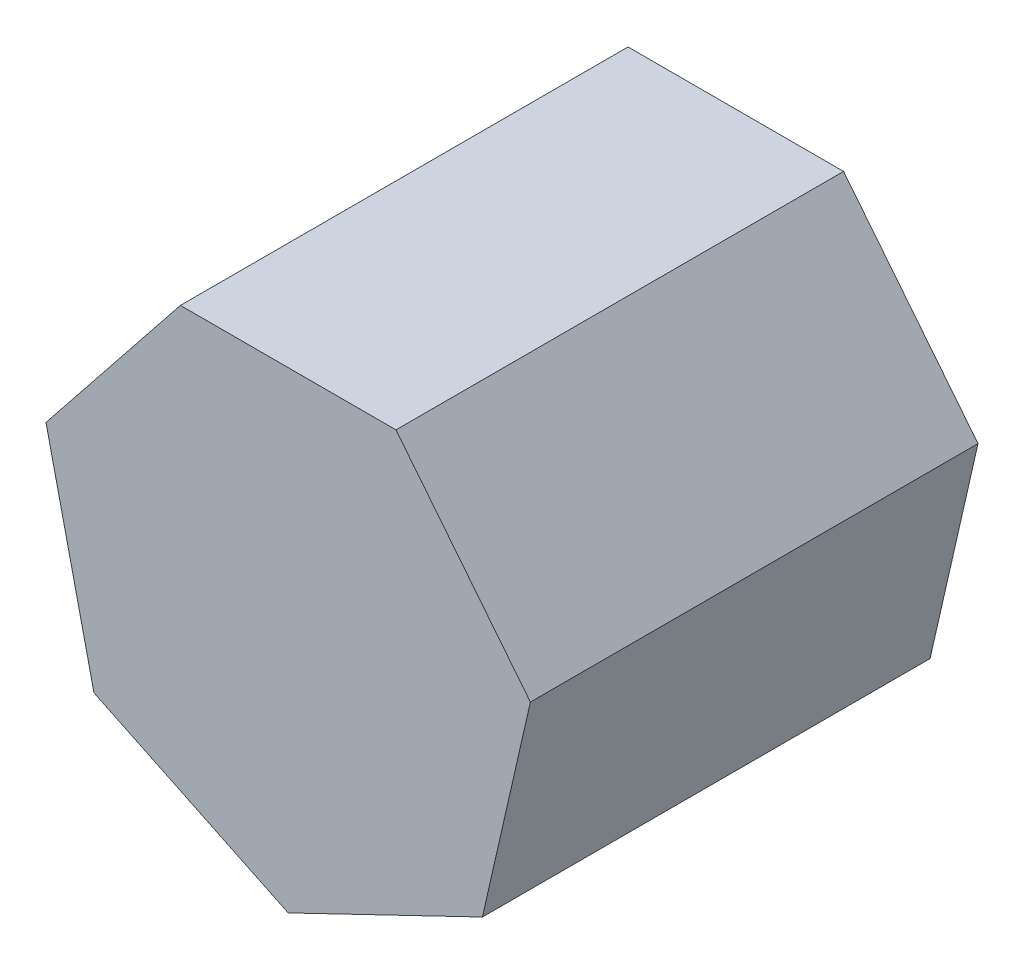
from build123d import *

# Parameters (mm, degrees)
BOSS_EXTRUDE1_DEPTH = 200
CUT_EXTRUDE1_DEPTH  = 1
SKETCH4_W           = 1.794871794
SKETCH4_H           = 20.512820513
SKETCH4_W_2         = 1.794871795
SKETCH4_H_2         = 14.615384616
CUT_EXTRUDE3_DEPTH  = 1
CUT_EXTRUDE5_DEPTH  = 2


with BuildPart() as part:
    # Sketch1 → Boss-Extrude1 (new body)
    with BuildSketch(Plane.XY):
        Polygon((0, -110.991626417), (86.776747824, -69.202147163), (108.208834613, 24.697960372), (48.157461881, 100), (-48.157461881, 100), (-108.208834613, 24.697960372), (-86.776747824, -69.202147163), align=None)
    extrude(amount=BOSS_EXTRUDE1_DEPTH)

    # Sketch2 → Cut-Extrude1 (cut)
    # profile 1 of 6: a face of its own
    with BuildSketch(Plane(origin=(-78.183148247, 62.348980186, 0), x_dir=(0, 0, 1), z_dir=(-0.7818314824680302, 0.6234898018587328, 0))):
        with BuildLine():
            Line((145.128205128, -35.364993932), (143.91025641, -36.619000342))
            add(Edge.make_bspline(
                [(143.91025641, -36.619000342), (143.805167819, -36.497210935), (143.602569386, -36.262415294), (143.281246637, -35.9484892), (142.961111759, -35.684849549), (142.64654711, -35.462265212), (142.329642716, -35.293984375), (142.014117469, -35.171156592), (141.699644678, -35.095146274), (141.489438762, -35.085349481), (141.386217949, -35.080538804)],
                knots=[0, 0, 0, 0, 1.26578478, 2.440284043, 3.530471711, 4.527705817, 5.468200915, 6.346673037, 7.188140097, 8, 8, 8, 8], degree=3))
            add(Edge.make_bspline(
                [(141.386217949, -35.080538804), (141.25970715, -35.086680935), (141.010751801, -35.09876778), (140.65403284, -35.219415954), (140.322886411, -35.404608745), (140.036275097, -35.667286365), (139.793488354, -35.968796473), (139.616267319, -36.305918329), (139.50789027, -36.668478579), (139.494148944, -36.920077766), (139.487179487, -37.04768624)],
                knots=[0, 0, 0, 0, 0.99966794, 1.967205029, 2.953328237, 3.988086729, 5.028030931, 6.008226631, 6.989793394, 8, 8, 8, 8], degree=3))
            add(Edge.make_bspline(
                [(139.487179487, -37.04768624), (139.493526986, -37.163183635), (139.50620409, -37.39385284), (139.604756542, -37.734127319), (139.761705526, -38.065881823), (139.908392351, -38.26909843), (139.983974359, -38.373808035)],
                knots=[0, 0, 0, 0, 0.960159726, 1.917612774, 2.927026955, 4, 4, 4, 4], degree=3))
            add(Edge.make_bspline(
                [(139.983974359, -38.373808035), (140.029480038, -38.429719945), (140.126333139, -38.5487214), (140.308096082, -38.713886276), (140.513938956, -38.896413425), (140.761481457, -39.078909636), (141.040058759, -39.271090923), (141.355711812, -39.465388826), (141.698423269, -39.676614111), (141.943779307, -39.810582314), (142.071314103, -39.880218291)],
                knots=[0, 0, 0, 0, 0.66740084, 1.420478572, 2.27185888, 3.217733974, 4.268547843, 5.408967954, 6.65319498, 8, 8, 8, 8], degree=3))
            add(Edge.make_bspline(
                [(142.071314103, -39.880218291), (142.226820257, -39.967332021), (142.527206943, -40.135607064), (142.954022756, -40.396805369), (143.341377276, -40.656413508), (143.69255252, -40.911655073), (144.000791428, -41.169671459), (144.275446014, -41.420572928), (144.509665694, -41.671940404), (144.640830989, -41.847558196), (144.703525641, -41.931500342)],
                knots=[0, 0, 0, 0, 1.27191281, 2.456916733, 3.569705269, 4.599008579, 5.553216877, 6.436649441, 7.252746552, 8, 8, 8, 8], degree=3))
            add(Edge.make_bspline(
                [(144.703525641, -41.931500342), (144.807585798, -42.101020845), (145.014684822, -42.438398109), (145.232160631, -42.99393198), (145.358219344, -43.583134851), (145.375717745, -43.986176109), (145.384615385, -44.191115727)],
                knots=[0, 0, 0, 0, 0.995354457, 1.980940102, 2.973342416, 4, 4, 4, 4], degree=3))
            add(Edge.make_bspline(
                [(145.384615385, -44.191115727), (145.380503763, -44.335510848), (145.372401363, -44.620057209), (145.316069552, -45.039113379), (145.219183973, -45.439882279), (145.087219665, -45.826712477), (144.909023248, -46.192192132), (144.700178693, -46.545542126), (144.449464911, -46.879118874), (144.163228479, -47.19248436), (143.849825657, -47.478688631), (143.515504866, -47.730254082), (143.159854405, -47.939250295), (142.78541554, -48.112195125), (142.391337517, -48.249728027), (141.977558721, -48.344942491), (141.545394409, -48.401929698), (141.251509791, -48.40984099), (141.101762821, -48.413872137)],
                knots=[0, 0, 0, 0, 1.032770009, 2.035186124, 3.017557409, 3.978232242, 4.952395191, 5.920591857, 6.910227898, 7.931268572, 8.952309245, 9.941945286, 10.918353717, 11.897095711, 12.887975737, 13.898235213, 14.929059601, 16, 16, 16, 16], degree=3))
            add(Edge.make_bspline(
                [(141.101762821, -48.413872137), (140.899664675, -48.408199564), (140.498276521, -48.396933237), (139.904620983, -48.291184316), (139.324502362, -48.126639208), (138.762310703, -47.899691013), (138.230618624, -47.613115511), (137.744156198, -47.269901833), (137.301233555, -46.881387562), (137.049129134, -46.583599501), (136.923076923, -46.43470547)],
                knots=[0, 0, 0, 0, 1.013940152, 2.01379169, 3.017749504, 4.037548394, 5.051665909, 6.043208538, 7.021604269, 8, 8, 8, 8], degree=3))
            Line((136.923076923, -46.43470547), (138.112980769, -45.080538804))
            add(Edge.make_bspline(
                [(138.112980769, -45.080538804), (138.225965986, -45.20256603), (138.445004913, -45.439134258), (138.795297581, -45.75413049), (139.151751301, -46.018137754), (139.510806653, -46.238957267), (139.877778621, -46.409102428), (140.250610702, -46.52863725), (140.628544554, -46.605461206), (140.88238533, -46.614479962), (141.009615385, -46.619000342)],
                knots=[0, 0, 0, 0, 1.179806542, 2.287233372, 3.337373186, 4.324005949, 5.273901747, 6.200048787, 7.097828587, 8, 8, 8, 8], degree=3))
            add(Edge.make_bspline(
                [(141.009615385, -46.619000342), (141.182860676, -46.611167057), (141.521352913, -46.595862133), (142.006174391, -46.456907321), (142.453823685, -46.239021882), (142.842528517, -45.929966464), (143.173398009, -45.570220335), (143.412987577, -45.164996796), (143.563137151, -44.726188472), (143.580771429, -44.422003886), (143.58974359, -44.267237522)],
                knots=[0, 0, 0, 0, 1.072336372, 2.095165389, 3.102688358, 4.141489647, 5.156069229, 6.117746104, 7.042326257, 8, 8, 8, 8], degree=3))
            add(Edge.make_bspline(
                [(143.58974359, -44.267237522), (143.583536194, -44.139753987), (143.571280521, -43.888054811), (143.475033252, -43.523767148), (143.322959811, -43.178228402), (143.173218963, -42.976001846), (143.096955128, -42.873006753)],
                knots=[0, 0, 0, 0, 1.013901739, 2.00181326, 2.98231254, 4, 4, 4, 4], degree=3))
            add(Edge.make_bspline(
                [(143.096955128, -42.873006753), (143.051112874, -42.821376112), (142.951251889, -42.708905929), (142.768079082, -42.546476907), (142.548754155, -42.371402054), (142.290810367, -42.186650118), (141.993727727, -41.994658087), (141.656302153, -41.796433217), (141.283156139, -41.582560499), (141.01932396, -41.440733897), (140.881410256, -41.366596496)],
                knots=[0, 0, 0, 0, 0.615000592, 1.339693406, 2.178160186, 3.116406724, 4.166410947, 5.330106347, 6.604359322, 8, 8, 8, 8], degree=3))
            add(Edge.make_bspline(
                [(140.881410256, -41.366596496), (140.732572313, -41.283515744), (140.443928042, -41.122395651), (140.035086379, -40.871446621), (139.666244355, -40.616205051), (139.328526786, -40.370988827), (139.030463897, -40.122869147), (138.773229907, -39.871570567), (138.546697245, -39.62722779), (138.421283463, -39.45410038), (138.361378205, -39.371404188)],
                knots=[0, 0, 0, 0, 1.262093308, 2.447601706, 3.550203992, 4.582594899, 5.537233252, 6.418365656, 7.244515135, 8, 8, 8, 8], degree=3))
            add(Edge.make_bspline(
                [(138.361378205, -39.371404188), (138.257774779, -39.204857817), (138.05053172, -38.871706872), (137.849302056, -38.315647005), (137.710981891, -37.730246678), (137.698625376, -37.326321796), (137.692307692, -37.119801624)],
                knots=[0, 0, 0, 0, 0.985009483, 1.970363186, 2.962279964, 4, 4, 4, 4], degree=3))
            add(Edge.make_bspline(
                [(137.692307692, -37.119801624), (137.695360237, -36.98479935), (137.701334499, -36.720580773), (137.749014794, -36.332358943), (137.835824572, -35.96351235), (137.944709844, -35.608501704), (138.096041298, -35.274204024), (138.276875042, -34.956161332), (138.489374613, -34.654813229), (138.734193418, -34.374795331), (139.003374248, -34.120456324), (139.294201504, -33.898749878), (139.600134398, -33.709570708), (139.922468224, -33.550912648), (140.264299498, -33.430904747), (140.623238849, -33.348291118), (140.998559734, -33.293118531), (141.255137597, -33.28818662), (141.386217949, -33.285667009)],
                knots=[0, 0, 0, 0, 1.087655834, 2.128696564, 3.144119009, 4.137814668, 5.115653402, 6.093965665, 7.082169637, 8.081268856, 9.086088321, 10.061021666, 11.022561449, 11.980240094, 12.950172527, 13.934149372, 14.944599409, 16, 16, 16, 16], degree=3))
            add(Edge.make_bspline(
                [(141.386217949, -33.285667009), (141.541601169, -33.291977527), (141.855282436, -33.304716943), (142.325880299, -33.405892317), (142.795785111, -33.572367198), (143.266204254, -33.802288531), (143.733691622, -34.099813536), (144.202359374, -34.459409533), (144.677833833, -34.878710759), (144.974727051, -35.199277761), (145.128205128, -35.364993932)],
                knots=[0, 0, 0, 0, 0.845714091, 1.707292901, 2.609013841, 3.555613372, 4.552488639, 5.621697636, 6.770543573, 8, 8, 8, 8], degree=3))
        make_face()
    # profile 2 of 6: a face of its own
    with BuildSketch(Plane(origin=(-78.183148247, 62.348980186, 0), x_dir=(0, 0, 1), z_dir=(-0.7818314824680302, 0.6234898018587328, 0))):
        with BuildLine():
            Line((132.251602564, -43.542077265), (133.846153846, -44.379417009))
            add(Edge.make_bspline(
                [(133.846153846, -44.379417009), (133.719087588, -44.604807473), (133.471866968, -45.043328061), (133.046719837, -45.645795835), (132.601050851, -46.187782783), (132.114742462, -46.654809379), (131.602344297, -47.06196015), (131.061014841, -47.418176291), (130.487935882, -47.721710693), (129.883080312, -47.977439424), (129.241368591, -48.174065104), (128.56124564, -48.312946367), (127.841408524, -48.398793616), (127.348001782, -48.408765849), (127.095352564, -48.413872137)],
                knots=[0, 0, 0, 0, 1.120438281, 2.179929193, 3.190490725, 4.156257408, 5.095198341, 6.022838206, 6.959905092, 7.901321166, 8.864066838, 9.862729781, 10.905609505, 12, 12, 12, 12], degree=3))
            add(Edge.make_bspline(
                [(127.095352564, -48.413872137), (126.814541264, -48.40731685), (126.266759769, -48.394529383), (125.469389785, -48.284286729), (124.718650252, -48.104444679), (124.014583375, -47.853213013), (123.35891336, -47.525056876), (122.750337047, -47.125288408), (122.185654042, -46.655961239), (121.682658561, -46.113010133), (121.229836374, -45.531970377), (120.83026026, -44.92650818), (120.496217797, -44.298146897), (120.224488596, -43.65088676), (120.005032225, -42.988807368), (119.852079632, -42.305884696), (119.763909643, -41.603967072), (119.750398526, -41.129125154), (119.743589744, -40.889833676)],
                knots=[0, 0, 0, 0, 1.145258523, 2.234067595, 3.276747158, 4.290159414, 5.277019952, 6.260822364, 7.254936242, 8.264827045, 9.274100331, 10.257902744, 11.220704747, 12.172965371, 13.118907548, 14.062713208, 15.023725156, 16, 16, 16, 16], degree=3))
            add(Edge.make_bspline(
                [(119.743589744, -40.889833676), (119.74964198, -40.665291788), (119.761636713, -40.220279418), (119.837241212, -39.561619163), (119.971231458, -38.921456578), (120.155096166, -38.299259732), (120.392531859, -37.696070395), (120.683001683, -37.11152146), (121.026958127, -36.546234946), (121.292516263, -36.189645611), (121.426282051, -36.010025983)],
                knots=[0, 0, 0, 0, 1.024358464, 2.0301432, 3.019427413, 4.004406732, 4.986367066, 5.972626655, 6.978780325, 8, 8, 8, 8], degree=3))
            add(Edge.make_bspline(
                [(121.426282051, -36.010025983), (121.60746881, -35.79363244), (121.964102791, -35.367700152), (122.567281964, -34.808052576), (123.220425943, -34.339231003), (123.915349521, -33.950618797), (124.660129373, -33.655340814), (125.444753893, -33.435297487), (126.278157243, -33.311994567), (126.847901362, -33.294578375), (127.139423077, -33.285667009)],
                knots=[0, 0, 0, 0, 1.030682036, 2.02871468, 2.997146059, 3.962720338, 4.930598197, 5.918074684, 6.934738563, 8, 8, 8, 8], degree=3))
            add(Edge.make_bspline(
                [(127.139423077, -33.285667009), (127.439123679, -33.293404431), (128.027067941, -33.30858349), (128.884394347, -33.449305395), (129.695598442, -33.67246285), (130.460355609, -33.987627367), (131.178743385, -34.394253377), (131.84609224, -34.897921043), (132.473815168, -35.483167255), (132.839007048, -35.933242738), (133.024839744, -36.162269573)],
                knots=[0, 0, 0, 0, 1.056321875, 2.072262726, 3.055038591, 4.01806755, 4.982017516, 5.957941055, 6.960871419, 8, 8, 8, 8], degree=3))
            add(Edge.make_bspline(
                [(133.024839744, -36.162269573), (133.151279391, -36.334861467), (133.403317066, -36.678896431), (133.71901478, -37.239874471), (133.993057037, -37.826792153), (134.212102529, -38.449136708), (134.389471107, -39.099534309), (134.517795786, -39.782634564), (134.593050749, -40.498234058), (134.607843305, -40.985814375), (134.615384615, -41.234384958)],
                knots=[0, 0, 0, 0, 0.94817472, 1.890038105, 2.849395472, 3.817997239, 4.812318967, 5.836947057, 6.897266129, 8, 8, 8, 8], degree=3))
            Line((134.615384615, -41.234384958), (121.538461538, -41.234384958))
            add(Edge.make_bspline(
                [(121.538461538, -41.234384958), (121.547259289, -41.426959039), (121.564559712, -41.805648203), (121.645217673, -42.359766964), (121.772353523, -42.887614633), (121.951033881, -43.385232016), (122.167415854, -43.859118459), (122.432477093, -44.30575867), (122.748703115, -44.723118271), (123.101421398, -45.114930485), (123.494033371, -45.463849121), (123.907077641, -45.776144985), (124.346469441, -46.037891252), (124.808744203, -46.250347765), (125.293154404, -46.416669571), (125.799852662, -46.530199975), (126.327841898, -46.606240585), (126.687760379, -46.614695815), (126.87099359, -46.619000342)],
                knots=[0, 0, 0, 0, 1.094153842, 2.151609401, 3.174256925, 4.172055639, 5.149267565, 6.128595816, 7.11444997, 8.118368179, 9.117203808, 10.09244225, 11.054858984, 12.015122123, 12.976791628, 13.957293641, 14.960065497, 16, 16, 16, 16], degree=3))
            add(Edge.make_bspline(
                [(126.87099359, -46.619000342), (127.050143005, -46.615525733), (127.40560981, -46.608631441), (127.934986138, -46.54159195), (128.455783437, -46.433190375), (128.965846199, -46.285247575), (129.454822461, -46.10480842), (129.907654176, -45.887077805), (130.324112551, -45.646222109), (130.71335236, -45.370738252), (131.090900893, -45.033548612), (131.465429387, -44.612773063), (131.867010263, -44.115130047), (132.118379365, -43.740583384), (132.251602564, -43.542077265)],
                knots=[0, 0, 0, 0, 0.99110716, 1.966546729, 2.947904876, 3.932708344, 4.903319531, 5.828989031, 6.710028674, 7.56322171, 8.463672341, 9.504779593, 10.677557249, 12, 12, 12, 12], degree=3))
        make_face()
        with BuildLine():
            add(Edge.make_bspline(
                [(132.820512821, -39.439513163), (132.754817823, -39.201439599), (132.6283761, -38.743224624), (132.364168303, -38.10870525), (132.066616642, -37.544774387), (131.714492463, -37.055747912), (131.315528317, -36.621442124), (130.854698701, -36.241907352), (130.337922167, -35.90237906), (129.767869935, -35.615793349), (129.164202592, -35.371851299), (128.532167209, -35.208279209), (127.887265564, -35.096224681), (127.451069642, -35.085789776), (127.231570513, -35.080538804)],
                knots=[0, 0, 0, 0, 1.154881502, 2.222775134, 3.210006277, 4.132804581, 5.035138423, 5.962687519, 6.919655026, 7.923214229, 8.944639381, 9.960483929, 10.97369054, 12, 12, 12, 12], degree=3))
            add(Edge.make_bspline(
                [(127.231570513, -35.080538804), (127.052430864, -35.08403407), (126.698309441, -35.090943476), (126.176589051, -35.156487072), (125.6755622, -35.264829043), (125.191531985, -35.413200223), (124.730841309, -35.610963666), (124.284014062, -35.842867818), (123.862411798, -36.125962583), (123.598747252, -36.341727468), (123.465544872, -36.450731112)],
                knots=[0, 0, 0, 0, 1.04873581, 2.073130211, 3.073294108, 4.04793562, 5.032784715, 6.005352987, 6.992311501, 8, 8, 8, 8], degree=3))
            add(Edge.make_bspline(
                [(123.465544872, -36.450731112), (123.370154689, -36.536984344), (123.177108208, -36.711539864), (122.919162371, -37.012278187), (122.672188241, -37.336572828), (122.447424511, -37.696830683), (122.241266874, -38.08894942), (122.048352719, -38.509621621), (121.874716078, -38.962039509), (121.777024021, -39.27731059), (121.726762821, -39.439513163)],
                knots=[0, 0, 0, 0, 0.879870761, 1.780643979, 2.707998968, 3.669668524, 4.684282772, 5.740141944, 6.837334558, 8, 8, 8, 8], degree=3))
            Line((121.726762821, -39.439513163), (132.820512821, -39.439513163))
        make_face(mode=Mode.SUBTRACT)
    # profile 3 of 6: a face of its own
    with BuildSketch(Plane(origin=(-78.183148247, 62.348980186, 0), x_dir=(0, 0, 1), z_dir=(-0.7818314824680302, 0.6234898018587328, 0))):
        with BuildLine():
            Line((111.538461538, -33.542077265), (113.333333333, -33.542077265))
            Line((113.333333333, -33.542077265), (113.333333333, -35.693519573))
            add(Edge.make_bspline(
                [(113.333333333, -35.693519573), (113.465840526, -35.493200554), (113.719259503, -35.110091987), (114.140476242, -34.603410267), (114.571923849, -34.183895715), (115.015667777, -33.849589893), (115.474971205, -33.599229214), (115.939753786, -33.415840442), (116.4173279, -33.307398641), (116.738253181, -33.29292059), (116.899038462, -33.285667009)],
                knots=[0, 0, 0, 0, 1.2804753, 2.448899062, 3.506932113, 4.484331642, 5.4025378, 6.288909075, 7.142734305, 8, 8, 8, 8], degree=3))
            add(Edge.make_bspline(
                [(116.899038462, -33.285667009), (117.023760327, -33.292470018), (117.280383671, -33.306467651), (117.668855613, -33.404815221), (118.06910391, -33.561832493), (118.327060408, -33.709490908), (118.461538462, -33.786468291)],
                knots=[0, 0, 0, 0, 0.901110191, 1.854092781, 2.881294221, 4, 4, 4, 4], degree=3))
            Line((118.461538462, -33.786468291), (117.475961538, -35.34095547))
            add(Edge.make_bspline(
                [(117.475961538, -35.34095547), (117.389624275, -35.302439664), (117.22573962, -35.22932929), (116.985999242, -35.142803518), (116.764963032, -35.091855428), (116.624142698, -35.084137042), (116.55849359, -35.080538804)],
                knots=[0, 0, 0, 0, 1.180555205, 2.24091978, 3.179933427, 4, 4, 4, 4], degree=3))
            add(Edge.make_bspline(
                [(116.55849359, -35.080538804), (116.414460827, -35.090139017), (116.120675741, -35.10972067), (115.689335745, -35.263656715), (115.270780285, -35.512372372), (114.938370786, -35.788207297), (114.680986483, -36.054194711), (114.497328052, -36.286471297), (114.328855212, -36.54692062), (114.167882524, -36.831090242), (114.021217986, -37.143832219), (113.884334162, -37.48202201), (113.760569231, -37.846051318), (113.689996407, -38.099665719), (113.653846154, -38.229577265)],
                knots=[0, 0, 0, 0, 1.125678352, 2.296057538, 3.5422874, 4.923748041, 5.663163013, 6.437101912, 7.23742474, 8.08941207, 8.991984279, 9.93940061, 10.944477711, 12, 12, 12, 12], degree=3))
            add(Edge.make_bspline(
                [(113.653846154, -38.229577265), (113.626803906, -38.345446829), (113.566907382, -38.602089107), (113.508670023, -39.032652105), (113.45112992, -39.541358727), (113.410577815, -40.129624972), (113.372989003, -40.795981794), (113.351788533, -41.54144434), (113.334056302, -42.366777776), (113.333581634, -42.94377408), (113.333333333, -43.245602906)],
                knots=[0, 0, 0, 0, 0.566838948, 1.255505196, 2.06880316, 3.007127437, 4.065329342, 5.249902469, 6.561414163, 8, 8, 8, 8], degree=3))
            Line((113.333333333, -43.245602906), (113.333333333, -48.157461881))
            Line((113.333333333, -48.157461881), (111.538461538, -48.157461881))
            Line((111.538461538, -48.157461881), (111.538461538, -33.542077265))
        make_face()
    # profile 4 of 6: a face of its own
    with BuildSketch(Plane(origin=(-78.183148247, 62.348980186, 0), x_dir=(0, 0, 1), z_dir=(-0.7818314824680302, 0.6234898018587328, 0))):
        with BuildLine():
            Line((107.948717949, -27.644641368), (107.948717949, -48.157461881))
            Line((107.948717949, -48.157461881), (106.153846154, -48.157461881))
            Line((106.153846154, -48.157461881), (106.153846154, -45.629417009))
            add(Edge.make_bspline(
                [(106.153846154, -45.629417009), (105.951453065, -45.858214689), (105.556480406, -46.304716238), (104.896816875, -46.888042938), (104.197570144, -47.370204775), (103.462134023, -47.759632865), (102.691172632, -48.052158901), (101.886394991, -48.26007981), (101.047472814, -48.393758868), (100.474602216, -48.407107565), (100.184294872, -48.413872137)],
                knots=[0, 0, 0, 0, 1.074387032, 2.096679803, 3.090159297, 4.057316773, 5.018401886, 5.985159533, 6.978961417, 8, 8, 8, 8], degree=3))
            add(Edge.make_bspline(
                [(100.184294872, -48.413872137), (99.926192278, -48.406864296), (99.417202536, -48.393044522), (98.668464953, -48.285831358), (97.947937813, -48.113656377), (97.254940255, -47.874222723), (96.593956567, -47.556618028), (95.959327443, -47.176382325), (95.354340631, -46.723577582), (94.788217551, -46.205931705), (94.266891835, -45.643674636), (93.809398849, -45.043985797), (93.427952678, -44.409458346), (93.108980788, -43.748126038), (92.863287391, -43.054897926), (92.692009481, -42.332171252), (92.584921215, -41.580800546), (92.571107153, -41.069146129), (92.564102564, -40.80970547)],
                knots=[0, 0, 0, 0, 1.033919861, 2.038935746, 3.024066025, 3.998881131, 4.97069526, 5.957263378, 6.95902576, 7.993208707, 9.027059324, 10.027763471, 11.009749337, 11.988697705, 12.965288445, 13.950418724, 14.960734635, 16, 16, 16, 16], degree=3))
            add(Edge.make_bspline(
                [(92.564102564, -40.80970547), (92.571262401, -40.555627164), (92.585417011, -40.05332806), (92.690863982, -39.314592643), (92.868184031, -38.603059724), (93.117028875, -37.921020049), (93.43612576, -37.267648333), (93.824286258, -36.642482476), (94.281538399, -36.043800205), (94.80869501, -35.485678909), (95.37975084, -34.970132542), (95.990657874, -34.522080853), (96.626219481, -34.135127432), (97.296293827, -33.828536138), (97.990962997, -33.580484112), (98.716411259, -33.408867152), (99.46962028, -33.307739602), (99.98099452, -33.293095235), (100.240384615, -33.285667009)],
                knots=[0, 0, 0, 0, 1.020392517, 2.01726096, 2.990465484, 3.961182959, 4.928053699, 5.906110375, 6.912531644, 7.948652711, 8.985773172, 9.998621852, 10.987621588, 11.969261332, 12.953316658, 13.946091881, 14.958173133, 16, 16, 16, 16], degree=3))
            add(Edge.make_bspline(
                [(100.240384615, -33.285667009), (100.538766374, -33.294621843), (101.124456606, -33.312199188), (101.981019586, -33.459092714), (102.791234504, -33.70573773), (103.559765861, -34.043402195), (104.282031919, -34.482263631), (104.963327008, -35.012271904), (105.591803139, -35.648427025), (105.963642125, -36.126207444), (106.153846154, -36.370602906)],
                knots=[0, 0, 0, 0, 1.031072012, 2.023879775, 2.993683497, 3.952812103, 4.918022106, 5.908088563, 6.929940113, 8, 8, 8, 8], degree=3))
            Line((106.153846154, -36.370602906), (106.153846154, -27.644641368))
            Line((106.153846154, -27.644641368), (107.948717949, -27.644641368))
        make_face()
        with BuildLine():
            add(Edge.make_bspline(
                [(100.264423077, -35.080538804), (100.002055432, -35.089873877), (99.484183432, -35.108299825), (98.723931992, -35.252148369), (97.996426768, -35.491488909), (97.305306344, -35.818814058), (96.661487963, -36.230406839), (96.086095559, -36.728243315), (95.574422979, -37.298740538), (95.144090041, -37.939324026), (94.793287201, -38.626055975), (94.546618447, -39.343909907), (94.383937034, -40.07993835), (94.367316916, -40.579153698), (94.358974359, -40.829737522)],
                knots=[0, 0, 0, 0, 1.031046209, 2.035121221, 3.029706178, 4.034933723, 5.034054252, 6.02443088, 7.017295772, 8.038157696, 9.050218397, 10.03989886, 11.016116709, 12, 12, 12, 12], degree=3))
            add(Edge.make_bspline(
                [(94.358974359, -40.829737522), (94.369630892, -41.078823849), (94.390902189, -41.576020168), (94.543763299, -42.313052035), (94.800219719, -43.031075133), (95.150174363, -43.723995095), (95.588383647, -44.367332812), (96.096318805, -44.948704941), (96.678891841, -45.448645445), (97.324191881, -45.867145866), (98.013380284, -46.205217414), (98.738145606, -46.44044964), (99.484863539, -46.592322672), (99.992591161, -46.610062539), (100.248397436, -46.619000342)],
                knots=[0, 0, 0, 0, 0.979072187, 1.954306742, 2.945804271, 3.96968567, 4.997920485, 5.998718438, 6.996577872, 8.005894225, 9.015743152, 10.005417472, 10.995077863, 12, 12, 12, 12], degree=3))
            add(Edge.make_bspline(
                [(100.248397436, -46.619000342), (100.508091737, -46.609514834), (101.024597946, -46.590649099), (101.787104848, -46.446184726), (102.527076064, -46.207505878), (103.234431655, -45.876653726), (103.893380976, -45.466611692), (104.484797419, -44.986571172), (104.984888667, -44.428267263), (105.408846436, -43.814687531), (105.741277389, -43.142047551), (105.983426298, -42.425852175), (106.126591474, -41.666076472), (106.144635644, -41.146854032), (106.153846154, -40.881820855)],
                knots=[0, 0, 0, 0, 1.01762866, 2.023962475, 3.030623092, 4.058876274, 5.077231937, 6.066672613, 7.034107872, 8.005628644, 8.981990164, 9.965428785, 10.961468474, 12, 12, 12, 12], degree=3))
            add(Edge.make_bspline(
                [(106.153846154, -40.881820855), (106.148362403, -40.679890395), (106.137568646, -40.282427347), (106.055108249, -39.698841533), (105.923937241, -39.140363098), (105.739101984, -38.606404875), (105.496294644, -38.099919073), (105.203450268, -37.617269014), (104.855419126, -37.160964949), (104.45780372, -36.737290258), (104.022573991, -36.350853331), (103.562033759, -36.005914812), (103.070726634, -35.722550397), (102.556914994, -35.488028845), (102.019707369, -35.301405132), (101.454732398, -35.176904024), (100.86799533, -35.091416476), (100.467732156, -35.084202871), (100.264423077, -35.080538804)],
                knots=[0, 0, 0, 0, 1.050140795, 2.067009409, 3.05949893, 4.030605086, 5.00011959, 5.97591094, 6.962425594, 7.979863591, 8.993523472, 9.986985069, 10.967611495, 11.937549037, 12.921786183, 13.919465291, 14.943216303, 16, 16, 16, 16], degree=3))
        make_face(mode=Mode.SUBTRACT)
    # profile 5 of 6: a face of its own
    with BuildSketch(Plane(origin=(-78.183148247, 62.348980186, 0), x_dir=(0, 0, 1), z_dir=(-0.7818314824680302, 0.6234898018587328, 0))):
        with BuildLine():
            Line((76.153846154, -33.542077265), (77.948717949, -33.542077265))
            Line((77.948717949, -33.542077265), (77.948717949, -36.178295214))
            add(Edge.make_bspline(
                [(77.948717949, -36.178295214), (78.140361578, -35.939193941), (78.512252727, -35.475209578), (79.131591774, -34.865377723), (79.786128347, -34.36283358), (80.471854082, -33.962240472), (81.189699854, -33.660259751), (81.935289968, -33.442168716), (82.713088288, -33.311398268), (83.242027928, -33.294311237), (83.509615385, -33.285667009)],
                knots=[0, 0, 0, 0, 1.12780773, 2.188550248, 3.19190651, 4.159438251, 5.104880172, 6.052711206, 7.014878035, 8, 8, 8, 8], degree=3))
            add(Edge.make_bspline(
                [(83.509615385, -33.285667009), (83.780076151, -33.295639554), (84.30943311, -33.315158231), (85.080164889, -33.469539323), (85.800012853, -33.733226495), (86.466410315, -34.094438326), (87.067137248, -34.543618174), (87.594707828, -35.066919784), (88.031069241, -35.66884026), (88.323625601, -36.227258296), (88.516343588, -36.722622834), (88.637671231, -37.146889978), (88.740705411, -37.619565127), (88.830029685, -38.139219922), (88.890470325, -38.709495295), (88.938140562, -39.328053535), (88.972304529, -39.994694281), (88.973659998, -40.455760723), (88.974358974, -40.693519573)],
                knots=[0, 0, 0, 0, 1.235846778, 2.418850247, 3.575807741, 4.728682307, 5.871620074, 6.994088408, 8.11269785, 9.256955736, 9.865816715, 10.540099792, 11.271859618, 12.076849838, 12.949306005, 13.892391288, 14.913166135, 16, 16, 16, 16], degree=3))
            Line((88.974358974, -40.693519573), (88.974358974, -48.157461881))
            Line((88.974358974, -48.157461881), (87.179487179, -48.157461881))
            Line((87.179487179, -48.157461881), (87.179487179, -41.282461881))
            add(Edge.make_bspline(
                [(87.179487179, -41.282461881), (87.178383134, -41.083476481), (87.176271282, -40.702851277), (87.169610444, -40.15788543), (87.153554406, -39.66367641), (87.130992618, -39.22140574), (87.097969586, -38.831498102), (87.06355455, -38.493159378), (87.021468968, -38.206819135), (86.983966608, -38.034447236), (86.967147436, -37.957141368)],
                knots=[0, 0, 0, 0, 1.430800155, 2.736877192, 3.918605307, 4.986035426, 5.920637409, 6.731861385, 7.431261377, 8, 8, 8, 8], degree=3))
            add(Edge.make_bspline(
                [(86.967147436, -37.957141368), (86.906430113, -37.730220311), (86.789568052, -37.293467485), (86.500802434, -36.701042613), (86.136149973, -36.197052968), (85.691019405, -35.784614559), (85.169710401, -35.463638349), (84.573669585, -35.240930036), (83.908648781, -35.101637069), (83.440909452, -35.087767743), (83.197115385, -35.080538804)],
                knots=[0, 0, 0, 0, 1.084156227, 2.086665306, 3.027808233, 3.945421172, 4.874247719, 5.839848303, 6.874090471, 8, 8, 8, 8], degree=3))
            add(Edge.make_bspline(
                [(83.197115385, -35.080538804), (83.052728621, -35.08325883), (82.766990947, -35.088641693), (82.343276822, -35.14264911), (81.932281546, -35.230983142), (81.529880352, -35.350232499), (81.144121531, -35.514016895), (80.762611295, -35.69989901), (80.3997155, -35.931603079), (80.047696088, -36.189835201), (79.72019433, -36.4760021), (79.415460968, -36.777970729), (79.143815138, -37.099545608), (78.897708422, -37.435545308), (78.685261203, -37.790584382), (78.499814985, -38.161237562), (78.342468158, -38.547992698), (78.264281344, -38.81642162), (78.225160256, -38.950731112)],
                knots=[0, 0, 0, 0, 1.023777757, 2.026029729, 3.023749952, 4.003683103, 4.997618607, 5.993177895, 7.010360494, 8.046726602, 9.087585522, 10.09234134, 11.086953743, 12.070360549, 13.043493632, 14.017870808, 15.008233677, 16, 16, 16, 16], degree=3))
            add(Edge.make_bspline(
                [(78.225160256, -38.950731112), (78.202647979, -39.049332272), (78.153639928, -39.26398184), (78.100707472, -39.616235665), (78.052664184, -40.023721236), (78.012452992, -40.485963048), (77.987850612, -41.004579477), (77.961025487, -41.577355693), (77.951259424, -42.206575627), (77.94958883, -42.644642442), (77.948717949, -42.873006753)],
                knots=[0, 0, 0, 0, 0.615963638, 1.340920617, 2.168419149, 3.115676021, 4.16674242, 5.331190069, 6.6087489, 8, 8, 8, 8], degree=3))
            Line((77.948717949, -42.873006753), (77.948717949, -48.157461881))
            Line((77.948717949, -48.157461881), (76.153846154, -48.157461881))
            Line((76.153846154, -48.157461881), (76.153846154, -33.542077265))
        make_face()
    # profile 6 of 6: a face of its own
    with BuildSketch(Plane(origin=(-78.183148247, 62.348980186, 0), x_dir=(0, 0, 1), z_dir=(-0.7818314824680302, 0.6234898018587328, 0))):
        Polygon((63.846153846, -28.157461881), (73.076923077, -48.157461881), (71.125801282, -48.157461881), (68.169070513, -41.74720547), (59.102564103, -41.74720547), (56.065705128, -48.157461881), (54.102564103, -48.157461881), (63.58974359, -28.157461881), align=None)
        Polygon((63.697916667, -32.05970547), (60.080128205, -39.695923419), (67.223557692, -39.695923419), align=None, mode=Mode.SUBTRACT)
    extrude(amount=-CUT_EXTRUDE1_DEPTH, mode=Mode.SUBTRACT)

    # Sketch4 → Cut-Extrude3 (cut)
    # profile 1 of 6: a face of its own
    with BuildSketch(Plane(origin=(-97.492791218, -22.252093396, 0), x_dir=(0, 0, 1), z_dir=(-0.9749279121818235, -0.22252093395631528, 0))):
        Polygon((109.743589744, -33.542077265), (111.674679487, -33.542077265), (116.630608974, -44.735987522), (121.650641026, -33.542077265), (123.58974359, -33.542077265), (114.615384615, -53.542077265), (112.676282051, -53.542077265), (115.661057692, -46.90345547), align=None)
    # profile 2 of 6: a face of its own
    with BuildSketch(Plane(origin=(-97.492791218, -22.252093396, 0), x_dir=(0, 0, 1), z_dir=(-0.9749279121818235, -0.22252093395631528, 0))):
        with Locations((106.282051282, -37.901051624)):
            Rectangle(SKETCH4_W, SKETCH4_H)
    # profile 3 of 6: a face of its own
    with BuildSketch(Plane(origin=(-97.492791218, -22.252093396, 0), x_dir=(0, 0, 1), z_dir=(-0.9749279121818235, -0.22252093395631528, 0))):
        with Locations((100.641025641, -37.901051624)):
            Rectangle(SKETCH4_W, SKETCH4_H)
    # profile 4 of 6: a face of its own
    with BuildSketch(Plane(origin=(-97.492791218, -22.252093396, 0), x_dir=(0, 0, 1), z_dir=(-0.9749279121818235, -0.22252093395631528, 0))):
        with BuildLine():
            add(Edge.make_bspline(
                [(94.735576923, -27.388231112), (94.84695587, -27.393397697), (95.065057241, -27.403514863), (95.380447342, -27.490151874), (95.667630268, -27.63700722), (95.92236017, -27.834033968), (96.14094238, -28.065745073), (96.293975011, -28.335807749), (96.39233156, -28.6275714), (96.404209019, -28.831086195), (96.41025641, -28.93470547)],
                knots=[0, 0, 0, 0, 1.055194115, 2.066272739, 3.074728998, 4.095836921, 5.109056067, 6.073838105, 7.019297344, 8, 8, 8, 8], degree=3))
            add(Edge.make_bspline(
                [(96.41025641, -28.93470547), (96.40407264, -29.035634917), (96.391848058, -29.235160489), (96.294050982, -29.521866043), (96.139638194, -29.788176235), (95.922500333, -30.019437436), (95.667593128, -30.216355264), (95.380457209, -30.363239487), (95.065054646, -30.449868843), (94.846954993, -30.459987064), (94.735576923, -30.465154188)],
                knots=[0, 0, 0, 0, 0.96129708, 1.900370562, 2.859976407, 3.87933698, 4.906634145, 5.921202961, 6.938410037, 8, 8, 8, 8], degree=3))
            add(Edge.make_bspline(
                [(94.735576923, -30.465154188), (94.625472494, -30.460184359), (94.411168607, -30.450511234), (94.100500936, -30.361539704), (93.815766711, -30.216305001), (93.56054001, -30.0207268), (93.34779605, -29.786755959), (93.192948476, -29.522028565), (93.095377265, -29.235119111), (93.083122244, -29.035621017), (93.076923077, -28.93470547)],
                knots=[0, 0, 0, 0, 1.054934014, 2.053291228, 3.073705704, 4.106921865, 5.123545215, 6.088680038, 7.033164197, 8, 8, 8, 8], degree=3))
            add(Edge.make_bspline(
                [(93.076923077, -28.93470547), (93.082986429, -28.831100616), (93.094895235, -28.627614144), (93.193021613, -28.335642527), (93.346506229, -28.067176802), (93.560680878, -27.832745377), (93.815729222, -27.637057178), (94.100510623, -27.49185157), (94.411166048, -27.402872488), (94.625471625, -27.393200406), (94.735576923, -27.388231112)],
                knots=[0, 0, 0, 0, 0.98631895, 1.937192651, 2.907499808, 3.917963147, 4.944918757, 5.95915025, 6.951458133, 8, 8, 8, 8], degree=3))
        make_face()
    # profile 5 of 6: a face of its own
    with BuildSketch(Plane(origin=(-97.492791218, -22.252093396, 0), x_dir=(0, 0, 1), z_dir=(-0.9749279121818235, -0.22252093395631528, 0))):
        with Locations((94.743589744, -40.849769573)):
            Rectangle(SKETCH4_W_2, SKETCH4_H_2)
    # profile 6 of 6: a face of its own
    with BuildSketch(Plane(origin=(-97.492791218, -22.252093396, 0), x_dir=(0, 0, 1), z_dir=(-0.9749279121818235, -0.22252093395631528, 0))):
        with BuildLine():
            Line((78.717948718, -28.157461881), (82.620192308, -28.157461881))
            add(Edge.make_bspline(
                [(82.620192308, -28.157461881), (82.811212183, -28.158466169), (83.181456242, -28.160412729), (83.719853053, -28.19060205), (84.224131971, -28.231765878), (84.694439241, -28.297080693), (85.13055754, -28.375890848), (85.533801182, -28.471329797), (85.90288788, -28.585767589), (86.343532089, -28.767746339), (86.845935865, -29.038164444), (87.38992668, -29.437756245), (87.855093762, -29.926513177), (88.256158432, -30.477842637), (88.575021973, -31.084332761), (88.805703672, -31.731528125), (88.951748674, -32.411080936), (88.966768298, -32.877613381), (88.974358974, -33.113391368)],
                knots=[0, 0, 0, 0, 1.001505555, 1.941167018, 2.826882275, 3.653841531, 4.429895133, 5.150066043, 5.825578002, 6.45369114, 7.647487171, 8.808567382, 9.977351308, 11.170798116, 12.373658725, 13.556498008, 14.765093433, 16, 16, 16, 16], degree=3))
            add(Edge.make_bspline(
                [(88.974358974, -33.113391368), (88.968112012, -33.334263115), (88.955836141, -33.768296926), (88.838448945, -34.403120408), (88.654673697, -35.007413087), (88.39921513, -35.578969575), (88.067203723, -36.104875936), (87.673727617, -36.589374599), (87.199003031, -37.011952067), (86.843327374, -37.248197225), (86.662660256, -37.36819906)],
                knots=[0, 0, 0, 0, 1.044552857, 2.05264487, 3.044412934, 4.028983338, 5.005914585, 5.980388656, 6.974128949, 8, 8, 8, 8], degree=3))
            add(Edge.make_bspline(
                [(86.662660256, -37.36819906), (86.8898627, -37.455427626), (87.324557256, -37.622317479), (87.922763042, -37.917377274), (88.438162156, -38.238303619), (88.874717276, -38.588771334), (89.248075304, -38.966535967), (89.574092113, -39.37713662), (89.852271394, -39.825929522), (90.090630957, -40.308235438), (90.276623849, -40.819129543), (90.415914731, -41.353819692), (90.495728726, -41.910388579), (90.507086676, -42.289162175), (90.512820513, -42.480378547)],
                knots=[0, 0, 0, 0, 1.27268992, 2.434971085, 3.483601985, 4.442670788, 5.356604649, 6.2567628, 7.179492994, 8.113709626, 9.066344395, 10.018646069, 10.999752585, 12, 12, 12, 12], degree=3))
            add(Edge.make_bspline(
                [(90.512820513, -42.480378547), (90.507238536, -42.675617817), (90.496255839, -43.059756549), (90.415227429, -43.624071603), (90.278032532, -44.163357013), (90.089054552, -44.681100914), (89.842412755, -45.176301682), (89.542252958, -45.649520333), (89.184358309, -46.096002223), (88.783999058, -46.52070864), (88.331072512, -46.902581711), (87.842411056, -47.242671463), (87.311860656, -47.522363247), (86.748134976, -47.757311941), (86.144910313, -47.936781647), (85.504895413, -48.062339212), (84.82864226, -48.146939423), (84.364586539, -48.15389488), (84.126602564, -48.157461881)],
                knots=[0, 0, 0, 0, 0.978564426, 1.925352924, 2.850884081, 3.763762016, 4.682927383, 5.618979971, 6.567305752, 7.547517671, 8.540179244, 9.531824382, 10.526200242, 11.540722885, 12.589160233, 13.674978461, 14.80764778, 16, 16, 16, 16], degree=3))
            Line((84.126602564, -48.157461881), (78.717948718, -48.157461881))
            Line((78.717948718, -48.157461881), (78.717948718, -28.157461881))
        make_face()
        with BuildLine():
            Line((80.512820513, -30.208743932), (80.512820513, -36.619000342))
            Line((80.512820513, -36.619000342), (81.71875, -36.619000342))
            add(Edge.make_bspline(
                [(81.71875, -36.619000342), (81.895028831, -36.616715068), (82.235635455, -36.612299452), (82.728892007, -36.599650783), (83.186749254, -36.564233392), (83.608416871, -36.528826181), (83.993230837, -36.471257108), (84.340338617, -36.402730692), (84.655187742, -36.330256948), (85.018270859, -36.207002737), (85.430116279, -36.024844593), (85.869162589, -35.742148387), (86.256216701, -35.405437797), (86.583057773, -35.016918016), (86.850551891, -34.58911124), (87.036344549, -34.128843351), (87.16232903, -33.647585454), (87.173709209, -33.317195438), (87.179487179, -33.14944906)],
                knots=[0, 0, 0, 0, 1.156816544, 2.235205308, 3.236616184, 4.169592532, 5.011045266, 5.787822928, 6.49130361, 7.128639758, 8.301311294, 9.436451833, 10.541879658, 11.654887649, 12.756523258, 13.837046038, 14.901820046, 16, 16, 16, 16], degree=3))
            add(Edge.make_bspline(
                [(87.179487179, -33.14944906), (87.176480436, -33.038444652), (87.170582379, -32.820697382), (87.122277793, -32.503272502), (87.040177367, -32.204736773), (86.934724263, -31.920999), (86.787360328, -31.660931284), (86.613854823, -31.415541594), (86.404222307, -31.193186632), (86.165609092, -30.985360927), (85.891274104, -30.801106482), (85.581381008, -30.639730693), (85.231737139, -30.509783397), (84.848235111, -30.395976812), (84.424971754, -30.316043704), (83.966831448, -30.249452918), (83.470061625, -30.215551535), (83.126375325, -30.211063747), (82.948717949, -30.208743932)],
                knots=[0, 0, 0, 0, 0.91205012, 1.789085906, 2.630437955, 3.453916878, 4.269457761, 5.079663411, 5.91843418, 6.774407191, 7.675494373, 8.627863946, 9.638891023, 10.736472738, 11.911756761, 13.175263542, 14.539845004, 16, 16, 16, 16], degree=3))
            Line((82.948717949, -30.208743932), (80.512820513, -30.208743932))
        make_face(mode=Mode.SUBTRACT)
        with BuildLine():
            Line((80.512820513, -38.670282394), (80.512820513, -46.106179829))
            Line((80.512820513, -46.106179829), (83.068910256, -46.106179829))
            add(Edge.make_bspline(
                [(83.068910256, -46.106179829), (83.251875547, -46.103986987), (83.604517025, -46.099760573), (84.113666911, -46.085963118), (84.585570362, -46.054578686), (85.018073994, -46.00517383), (85.415848009, -45.951582692), (85.774120598, -45.87951823), (86.095795989, -45.796952741), (86.468792034, -45.6693289), (86.888812081, -45.471063352), (87.341445546, -45.172124915), (87.743881078, -44.815991728), (88.085625417, -44.403815075), (88.365699637, -43.955636064), (88.569445094, -43.480519779), (88.695107133, -42.986316765), (88.710319529, -42.649364122), (88.717948718, -42.480378547)],
                knots=[0, 0, 0, 0, 1.160039823, 2.235823828, 3.228722157, 4.157150951, 4.99529583, 5.772374946, 6.472645482, 7.099169577, 8.269452708, 9.405989375, 10.527446681, 11.663510218, 12.788923519, 13.866172445, 14.929861265, 16, 16, 16, 16], degree=3))
            add(Edge.make_bspline(
                [(88.717948718, -42.480378547), (88.716370979, -42.374702316), (88.71324095, -42.16505442), (88.666037436, -41.856964025), (88.597386751, -41.558530463), (88.508635701, -41.268943374), (88.379381603, -40.993438367), (88.22848706, -40.726566598), (88.051564765, -40.467975287), (87.775883817, -40.141048124), (87.374901048, -39.764379479), (86.805148046, -39.395593752), (86.157306343, -39.098177711), (85.687434955, -38.97189499), (85.444711538, -38.906660599)],
                knots=[0, 0, 0, 0, 0.723448775, 1.435228256, 2.130040452, 2.821711965, 3.505591119, 4.210454504, 4.921174351, 5.648778258, 7.137944449, 8.670945889, 10.280296675, 12, 12, 12, 12], degree=3))
            add(Edge.make_bspline(
                [(85.444711538, -38.906660599), (85.347402419, -38.886917262), (85.136416177, -38.844109635), (84.792372861, -38.798922759), (84.399596467, -38.758665273), (83.957180026, -38.72888723), (83.464563791, -38.698106981), (82.920695684, -38.686136574), (82.327796743, -38.671855088), (81.916411758, -38.670820035), (81.702724359, -38.670282394)],
                knots=[0, 0, 0, 0, 0.634451884, 1.375622551, 2.216452059, 3.157844607, 4.20941857, 5.370758133, 6.634282058, 8, 8, 8, 8], degree=3))
            Line((81.702724359, -38.670282394), (80.512820513, -38.670282394))
        make_face(mode=Mode.SUBTRACT)
    extrude(amount=-CUT_EXTRUDE3_DEPTH, mode=Mode.SUBTRACT)

    # Sketch7 → Cut-Extrude5 (cut)
    # profile 1 of 4: a face of its own
    with BuildSketch(Plane(origin=(-43.388373912, -90.09688679, 0), x_dir=(-0.9009688679024196, 0.43388373911755734, 0), z_dir=(-0.43388373911755734, -0.9009688679024196, 0))):
        Polygon((-29.107461881, -116.241346154), (-29.107461881, -118.214272837), (-36.899949862, -123.201923077), (-29.107461881, -128.189573317), (-29.107461881, -130.1625), (-38.441656592, -124.190294471), (-48.157461881, -130.406730769), (-48.157461881, -128.433804087), (-39.983363323, -123.201923077), (-48.157461881, -117.970042067), (-48.157461881, -115.997115385), (-38.441656592, -122.217367788), align=None)
    # profile 2 of 4: a face of its own
    with BuildSketch(Plane(origin=(-43.388373912, -90.09688679, 0), x_dir=(-0.9009688679024196, 0.43388373911755734, 0), z_dir=(-0.43388373911755734, -0.9009688679024196, 0))):
        Polygon((-29.107461881, -103.419230769), (-29.107461881, -114.165384615), (-31.061308035, -114.165384615), (-31.061308035, -105.128846154), (-36.922846496, -105.128846154), (-36.922846496, -114.165384615), (-38.87669265, -114.165384615), (-38.87669265, -105.128846154), (-46.203615727, -105.128846154), (-46.203615727, -114.165384615), (-48.157461881, -114.165384615), (-48.157461881, -103.419230769), align=None)
    # profile 3 of 4: a face of its own
    with BuildSketch(Plane(origin=(-43.388373912, -90.09688679, 0), x_dir=(-0.9009688679024196, 0.43388373911755734, 0), z_dir=(-0.43388373911755734, -0.9009688679024196, 0))):
        Polygon((-29.107461881, -91.207692308), (-29.107461881, -92.917307692), (-46.203615727, -92.917307692), (-46.203615727, -100.244230769), (-48.157461881, -100.244230769), (-48.157461881, -91.207692308), align=None)
    # profile 4 of 4: a face of its own
    with BuildSketch(Plane(origin=(-43.388373912, -90.09688679, 0), x_dir=(-0.9009688679024196, 0.43388373911755734, 0), z_dir=(-0.43388373911755734, -0.9009688679024196, 0))):
        Polygon((-29.107461881, -79.484615385), (-48.157461881, -88.276923077), (-48.157461881, -86.418479567), (-42.05169265, -83.60219351), (-42.05169265, -74.966346154), (-48.157461881, -72.069921875), (-48.157461881, -70.203846154), (-29.107461881, -79.240384615), align=None)
        Polygon((-32.820532794, -79.343419471), (-40.097846496, -75.893659856), (-40.097846496, -82.701592548), align=None, mode=Mode.SUBTRACT)
    extrude(amount=-CUT_EXTRUDE5_DEPTH, mode=Mode.SUBTRACT)


solid = part.part
